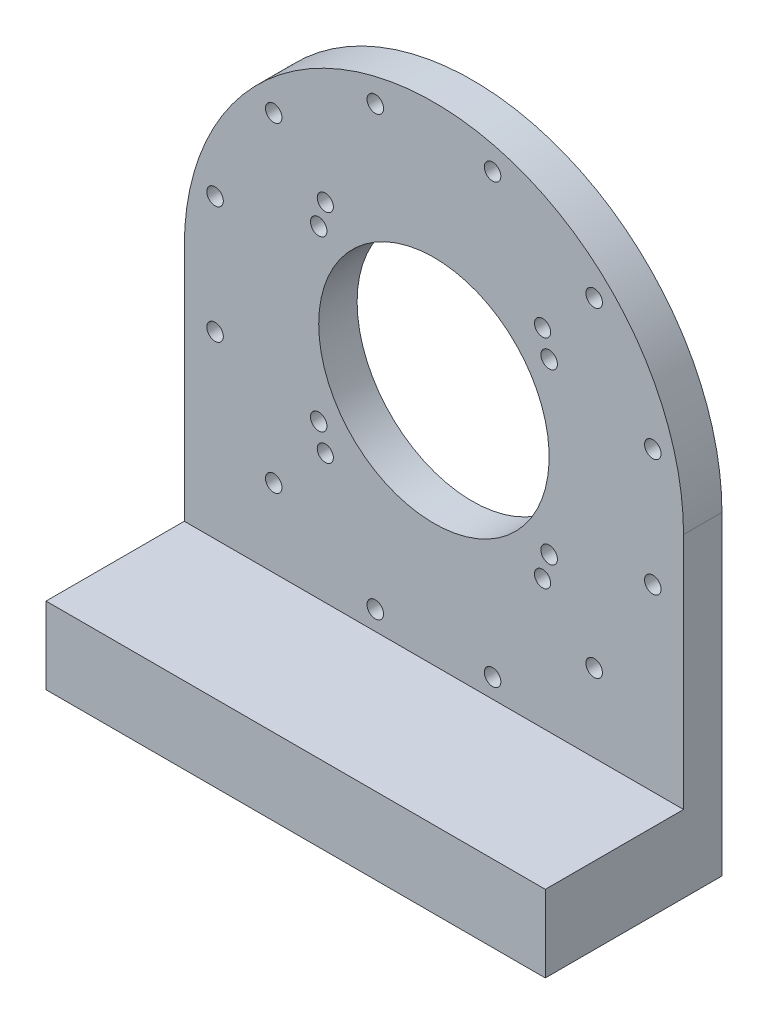
from build123d import *

# Parameters (mm, degrees)
SKETCH1_R           = 1.575
SKETCH1_R_2         = 2.1
SKETCH1_R_3         = 15
BOSS_EXTRUDE1_DEPTH = 10
SKETCH1_3_W         = 130
SKETCH1_3_H         = 20
BOSS_EXTRUDE2_DEPTH = 36
SKETCH2_R           = 30
CUT_EXTRUDE1_DEPTH  = 36
SKETCH4_R           = 2.15
CUT_EXTRUDE2_DEPTH  = 197.103143987
SKETCH5_R           = 2.15
CUT_EXTRUDE3_DEPTH  = 197.103143987


with BuildPart() as part:
    # Sketch1 → Boss-Extrude1 (new body)
    with BuildSketch(Plane(origin=(0, 0, -97.507071393), x_dir=(-1, 0, 0), z_dir=(0, 0, -1))):
        with BuildLine():
            ThreePointArc((-24.072792821, 47.25870832), (-89.072792821, 112.25870832), (-154.072792821, 47.25870832))
            Line((-154.072792821, 47.25870832), (-154.072792821, -34.74129168))
            Line((-154.072792821, -34.74129168), (-24.072792821, -34.74129168))
            Line((-24.072792821, -34.74129168), (-24.072792821, 47.25870832))
        make_face()
        with Locations((-32.08316907, 62.529031982)):
            Circle(SKETCH1_R, mode=Mode.SUBTRACT)
        with Locations((-60.788521574, 75.542979568)):
            Circle(SKETCH1_R_2, mode=Mode.SUBTRACT)
        with Locations((-73.80246916, 104.248332072)):
            Circle(SKETCH1_R, mode=Mode.SUBTRACT)
        with Locations((-47.353492731, 88.978008411)):
            Circle(SKETCH1_R, mode=Mode.SUBTRACT)
        with Locations((-104.343116482, -9.730915431)):
            Circle(SKETCH1_R, mode=Mode.SUBTRACT)
        with Locations((-130.792092911, 5.53940823)):
            Circle(SKETCH1_R, mode=Mode.SUBTRACT)
        with Locations((-146.062416572, 31.988384659)):
            Circle(SKETCH1_R, mode=Mode.SUBTRACT)
        with Locations((-117.357064069, 18.974437073)):
            Circle(SKETCH1_R_2, mode=Mode.SUBTRACT)
        with Locations((-73.80246916, -9.730915431)):
            Circle(SKETCH1_R, mode=Mode.SUBTRACT)
        with Locations((-60.788521574, 18.974437073)):
            Circle(SKETCH1_R_2, mode=Mode.SUBTRACT)
        with Locations((-47.353492731, 5.53940823)):
            Circle(SKETCH1_R, mode=Mode.SUBTRACT)
        with Locations((-32.08316907, 31.988384659)):
            Circle(SKETCH1_R, mode=Mode.SUBTRACT)
        with Locations((-146.062416572, 62.529031982)):
            Circle(SKETCH1_R, mode=Mode.SUBTRACT)
        with Locations((-89.072792821, 47.25870832)):
            Circle(SKETCH1_R_3, mode=Mode.SUBTRACT)
        with Locations((-130.792092911, 88.978008411)):
            Circle(SKETCH1_R, mode=Mode.SUBTRACT)
        with Locations((-117.357064069, 75.542979568)):
            Circle(SKETCH1_R_2, mode=Mode.SUBTRACT)
        with Locations((-104.343116482, 104.248332072)):
            Circle(SKETCH1_R, mode=Mode.SUBTRACT)
    extrude(amount=BOSS_EXTRUDE1_DEPTH)

    # Sketch1<3> → Boss-Extrude2 (add)
    with BuildSketch(Plane(origin=(0, 0, -97.507071393), x_dir=(-1, 0, 0), z_dir=(0, 0, -1))):
        with Locations((-89.072792821, -24.74129168)):
            Rectangle(SKETCH1_3_W, SKETCH1_3_H)
    extrude(amount=-BOSS_EXTRUDE2_DEPTH)

    # Sketch2 → Cut-Extrude1 (cut)
    with BuildSketch(Plane(origin=(0, 0, -107.507071393), x_dir=(-1, 0, 0), z_dir=(0, 0, -1))):
        with Locations((-89.072792821, 47.25870832)):
            Circle(SKETCH2_R)
    extrude(amount=-CUT_EXTRUDE1_DEPTH, mode=Mode.SUBTRACT)

    # Sketch4 → Cut-Extrude2 (cut, through all)
    with BuildSketch(Plane(origin=(0, 0, -107.507071393), x_dir=(-1, 0, 0), z_dir=(0, 0, -1))):
        with Locations((-73.80246916, 104.248332072)):
            Circle(SKETCH4_R)
        with Locations((-47.353492731, 88.978008411)):
            Circle(SKETCH4_R)
        with Locations((-32.08316907, 62.529031982)):
            Circle(SKETCH4_R)
        with Locations((-32.08316907, 31.988384659)):
            Circle(SKETCH4_R)
        with Locations((-47.353492731, 5.53940823)):
            Circle(SKETCH4_R)
        with Locations((-73.80246916, -9.730915431)):
            Circle(SKETCH4_R)
        with Locations((-104.343116482, -9.730915431)):
            Circle(SKETCH4_R)
        with Locations((-130.792092911, 5.53940823)):
            Circle(SKETCH4_R)
        with Locations((-146.062416572, 31.988384659)):
            Circle(SKETCH4_R)
        with Locations((-146.062416572, 62.529031982)):
            Circle(SKETCH4_R)
        with Locations((-130.792092911, 88.978008411)):
            Circle(SKETCH4_R)
        with Locations((-104.343116482, 104.248332072)):
            Circle(SKETCH4_R)
    extrude(amount=-CUT_EXTRUDE2_DEPTH, mode=Mode.SUBTRACT)

    # Sketch5 → Cut-Extrude3 (cut, through all)
    with BuildSketch(Plane(origin=(0, 0, -107.507071393), x_dir=(-1, 0, 0), z_dir=(0, 0, -1))):
        with Locations((-119.072792821, 69.25870832)):
            Circle(SKETCH5_R)
        with Locations((-59.072792821, 69.25870832)):
            Circle(SKETCH5_R)
        with Locations((-59.072792821, 25.25870832)):
            Circle(SKETCH5_R)
        with Locations((-119.072792821, 25.25870832)):
            Circle(SKETCH5_R)
    extrude(amount=-CUT_EXTRUDE3_DEPTH, mode=Mode.SUBTRACT)


solid = part.part
